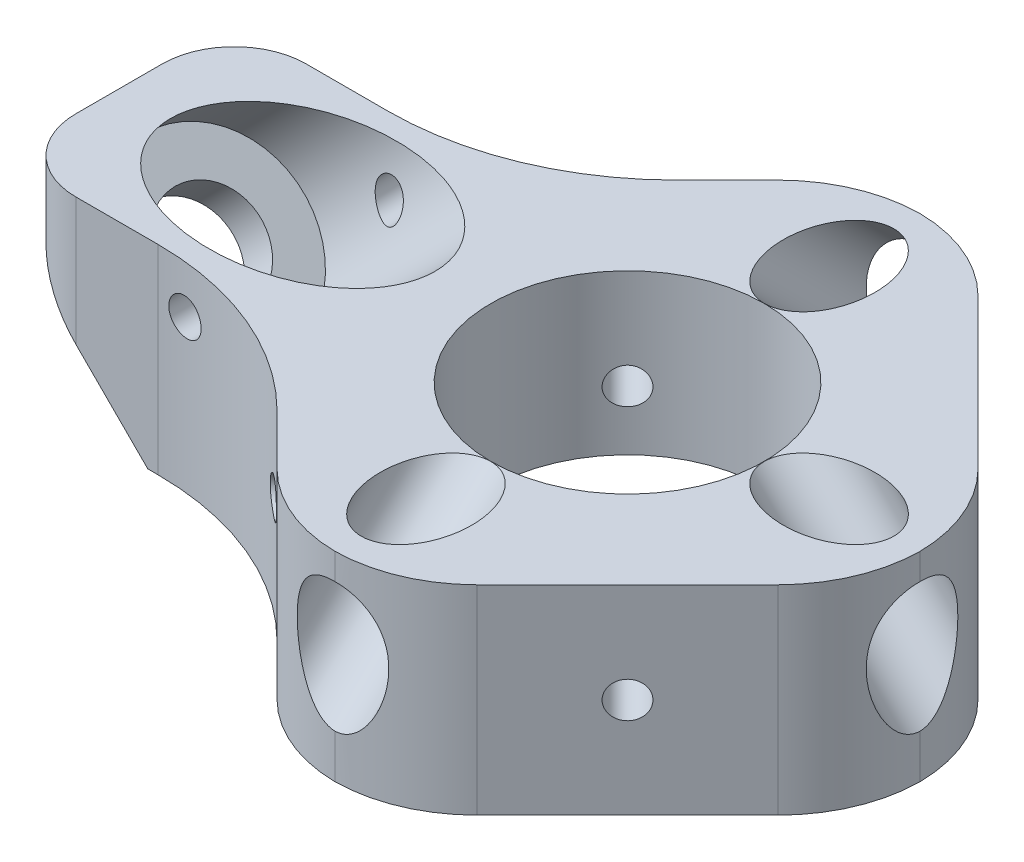
from build123d import *

# Parameters (mm, degrees)
BOSS_EXTRUDE1_DEPTH             = 13.86
SKETCH20_R                      = 15.5
CUT_EXTRUDE14_DEPTH             = 2.79
CHAMFER1_SIZE                   = 10
FILLET1_R                       = 2
SKETCH5_R                       = 1.25
CUT_EXTRUDE1_DEPTH              = 53.273499978
CIRPATTERN1_COUNT               = 4
SKETCH9_R                       = 9.5
CUT_EXTRUDE4_DEPTH              = 44.040729548
CUT_EXTRUDE5_DEPTH              = 44.040729548
CIRPATTERN3_COUNT               = 2
CIRPATTERN3_ANGLE               = 90
SKETCH7_R                       = 3.18
CUT_EXTRUDE2_DEPTH              = 56.113196242
CIRPATTERN2_COUNT               = 2
CIRPATTERN2_ANGLE               = 90
CIRPATTERN2_THE_OTHER_WAY_COUNT = 2
CIRPATTERN2_THE_OTHER_WAY_ANGLE = 90
CUT_EXTRUDE9_DEPTH              = 44.040729548
FILLET2_R                       = 20
FILLET3_R                       = 10
FILLET4_R                       = 5
CUT_EXTRUDE13_DEPTH             = 44.040395064
CUT_EXTRUDE13_DEPTH_BACK        = 44.040395064
SKETCH27_R                      = 1.25
CUT_EXTRUDE15_DEPTH             = 61.833411534
CUT_EXTRUDE15_DEPTH_BACK        = 61.833411534
SKETCH30_R                      = 3.5
CUT_EXTRUDE16_START             = -16
SKETCH31_R                      = 6.5
CUT_EXTRUDE16_DEPTH             = 15.523586
CUT_EXTRUDE17_DEPTH             = 44.040395146
CUT_EXTRUDE17_DEPTH_BACK        = 44.040395146


with BuildPart() as part:
    # Sketch1 → Boss-Extrude1 (new body)
    with BuildSketch(Plane(origin=(0, 0, 0), x_dir=(1, 0, 0), z_dir=(0, 1, 0))):
        Polygon((20.32, -20.32), (-20.32, -20.32), (-20.32, -8), (-35.32, -8), (-35.32, 8), (-20.32, 8), (-20.32, 20.32), (20.32, 20.32), align=None)
    extrude(amount=BOSS_EXTRUDE1_DEPTH)

    # Sketch20 → Cut-Extrude14 (cut)
    with BuildSketch(Plane.XZ):
        with Locations(Location((0, 0, 0), (0, 0, 270))):
            Circle(SKETCH20_R)
    extrude(amount=-CUT_EXTRUDE14_DEPTH, mode=Mode.SUBTRACT)

    # Chamfer1
    chamfer1_edges = [part.edges().sort_by_distance(p)[0] for p in [
        (-20.32, 6.93, -20.32),
        (20.32, 6.93, -20.32),
        (20.32, 6.93, 20.32),
        (-20.32, 6.93, 20.32),
    ]]
    chamfer(chamfer1_edges, length=CHAMFER1_SIZE)

    # Fillet1
    fillet1_edges = [part.edges().sort_by_distance(p)[0] for p in [
        (-20.32, 6.93, -10.32),
        (10.32, 6.93, -20.32),
        (-10.32, 6.93, -20.32),
        (20.32, 6.93, -10.32),
        (20.32, 6.93, 10.32),
        (-10.32, 6.93, 20.32),
        (10.32, 6.93, 20.32),
        (-20.32, 6.93, 10.32),
    ]]
    fillet(fillet1_edges, radius=FILLET1_R)

    # Sketch5 → Cut-Extrude1 (cut, through all)
    with BuildSketch(Plane(origin=(-15.32, 0, -15.32), x_dir=(-0.7071067811865487, 0, 0.7071067811865465), z_dir=(-0.7071067811865465, 0, -0.7071067811865487))):
        with Locations((0, 6.93)):
            Circle(SKETCH5_R)
    cut_extrude1 = extrude(amount=-CUT_EXTRUDE1_DEPTH, mode=Mode.SUBTRACT)

    # CirPattern1: Cut-Extrude1 ×4 about axis
    cirpattern1_axis = Axis((0, 13.86, 0), (0, 1, 0))
    for i in range(1, CIRPATTERN1_COUNT):
        add(cut_extrude1.rotate(cirpattern1_axis, i * 360 / CIRPATTERN1_COUNT), mode=Mode.SUBTRACT)

    # Sketch9 → Cut-Extrude4 (cut, through all)
    with BuildSketch(Plane(origin=(0, 13.86, 0), x_dir=(1, 0, 0), z_dir=(0, 1, 0))):
        with Locations(Location((0, 0, 0), (0, 0, 270))):
            Circle(SKETCH9_R)
    extrude(amount=-CUT_EXTRUDE4_DEPTH, mode=Mode.SUBTRACT)

    # Sketch10 → Cut-Extrude5 (cut, through all)
    with BuildSketch(Plane(origin=(0, 13.86, 0), x_dir=(1, 0, 0), z_dir=(0, 1, 0))):
        with BuildLine():
            Line((20.32, -9.491572875), (20.32, -4.023085751))
            Line((20.32, -4.023085751), (4.023085751, -20.32))
            Line((4.023085751, -20.32), (9.491572875, -20.32))
            ThreePointArc((9.491572875, -20.32), (10.25693974, -20.167759065), (10.905786438, -19.734213562))
            Line((10.905786438, -19.734213562), (19.734213562, -10.905786438))
            ThreePointArc((19.734213562, -10.905786438), (20.167759065, -10.25693974), (20.32, -9.491572875))
        make_face()
    cut_extrude5 = extrude(amount=-CUT_EXTRUDE5_DEPTH, mode=Mode.SUBTRACT)

    # CirPattern3: Cut-Extrude5 ×2 about axis
    cirpattern3_axis = Axis((0, 13.86, 0), (0, 1, 0))
    for i in range(1, CIRPATTERN3_COUNT):
        add(cut_extrude5.rotate(cirpattern3_axis, i * CIRPATTERN3_ANGLE / (CIRPATTERN3_COUNT - 1)), mode=Mode.SUBTRACT)

    # Sketch7 → Cut-Extrude2 (cut, symmetric)
    with BuildSketch(Plane(origin=(14, 13.86, 0), x_dir=(-0.7071067811865488, -0.7071067811865464, 0), z_dir=(-0.7071067811865464, 0.7071067811865488, 0))):
        Circle(SKETCH7_R)
    cut_extrude2 = extrude(amount=CUT_EXTRUDE2_DEPTH, both=True, mode=Mode.SUBTRACT)

    # CirPattern2: Cut-Extrude2 ×2 about axis
    cirpattern2_axis = Axis((0, 13.86, 0), (0, 1, 0))
    for i in range(1, CIRPATTERN2_COUNT):
        add(cut_extrude2.rotate(cirpattern2_axis, i * CIRPATTERN2_ANGLE / (CIRPATTERN2_COUNT - 1)), mode=Mode.SUBTRACT)

    # CirPattern2 the other way: Cut-Extrude2 ×2 about axis
    cirpattern2_the_other_way_axis = Axis((0, 13.86, 0), (0, -1, 0))
    for i in range(1, CIRPATTERN2_THE_OTHER_WAY_COUNT):
        add(cut_extrude2.rotate(cirpattern2_the_other_way_axis, i * CIRPATTERN2_THE_OTHER_WAY_ANGLE / (CIRPATTERN2_THE_OTHER_WAY_COUNT - 1)), mode=Mode.SUBTRACT)

    # Sketch19 → Cut-Extrude9 (cut, through all)
    with BuildSketch(Plane(origin=(0, 13.86, 0), x_dir=(1, 0, 0), z_dir=(0, 1, 0))):
        Polygon((-20.32, -8), (-17.403745922, -8), (-16.343085751, -8), (-4.023085751, -20.32), (-20.32, -20.32), align=None)
    cut_extrude9 = extrude(amount=-CUT_EXTRUDE9_DEPTH, mode=Mode.SUBTRACT)

    # Mirror1: Cut-Extrude9 across plane
    add(cut_extrude9.mirror(Plane.XY), mode=Mode.SUBTRACT)

    # Fillet2
    # the kernel refuses this fillet: 20 mm, written as the material it adds along each edge
    with BuildSketch(Plane(origin=(-16.343085751, 13.86, 8), x_dir=(-1, 0, 0), z_dir=(0, -1, 0))) as fillet2_piece_1_section:
        with BuildLine():
            CenterArc((FILLET2_R * 0.414213562373, -FILLET2_R), FILLET2_R, 90, 45)
            Line((-FILLET2_R * 0.292893218813, -FILLET2_R * 0.292893218813), (0, 0))
            Line((0, 0), (FILLET2_R * 0.414213562373, 0))
        make_face()
    fillet2_piece_1 = extrude(amount=13.86, mode=Mode.PRIVATE)
    fillet2_piece_1 = fillet2_piece_1 - Plane(origin=(-13.058090505, 6.93, 13.058090505), x_dir=(0.7071067811865464, 0, 0.7071067811865488), z_dir=(-0.7071067811865488, 0, 0.7071067811865464)) * Cylinder(1.25, 61, mode=Mode.PRIVATE)
    add(fillet2_piece_1)
    with BuildSketch(Plane(origin=(-16.343085751, 13.86, -8), x_dir=(0.7071067811865477, 0, -0.7071067811865475), z_dir=(0, -1, 0))) as fillet2_piece_2_section:
        with BuildLine():
            CenterArc((FILLET2_R * 0.414213562373, -FILLET2_R), FILLET2_R, 90, 45)
            Line((-FILLET2_R * 0.292893218813, -FILLET2_R * 0.292893218813), (0, 0))
            Line((0, 0), (FILLET2_R * 0.414213562373, 0))
        make_face()
    fillet2_piece_2 = extrude(amount=13.86, mode=Mode.PRIVATE)
    fillet2_piece_2 = fillet2_piece_2 - Plane(origin=(-13.058085033, 6.93, -13.058085033), x_dir=(-0.7071067811865487, 0, 0.7071067811865465), z_dir=(-0.7071067811865465, 0, -0.7071067811865487)) * Cylinder(1.25, 61, mode=Mode.PRIVATE)
    add(fillet2_piece_2)

    # Fillet3
    # the kernel refuses this fillet: 10 mm, written as the material it takes off along each edge
    with BuildSketch(Plane(origin=(-4.023085751, 24.215339059, -20.32), x_dir=(1, 0, 0), z_dir=(0, -1, 0)), Plane(origin=(4.023085751, 24.215339059, -20.32), x_dir=(0.7071067811865501, 0, 0.707106781186545), z_dir=(0, -1, 0)), Plane(origin=(20.32, 24.215339059, -4.023085751), x_dir=(0, 0, 1), z_dir=(0, -1, 0)), Plane(origin=(20.32, 24.215339059, 4.023085751), x_dir=(-0.7071067811865476, 0, 0.7071067811865476), z_dir=(0, -1, 0))) as fillet3_piece_1:
        with BuildLine():
            CenterArc((FILLET3_R * 0.414213562373, FILLET3_R), FILLET3_R, 225, 45)
            Line((-FILLET3_R * 0.292893218813, FILLET3_R * 0.292893218813), (0, 0))
            Line((0, 0), (FILLET3_R * 0.414213562373, 0))
        make_face()
    extrude(amount=34.570678119, mode=Mode.SUBTRACT)
    with BuildSketch(Plane(origin=(4.023085751, 24.215339059, 20.32), x_dir=(0.7071067811865472, 0, -0.7071067811865477), z_dir=(0, -1, 0)), Plane(origin=(-4.023085751, 24.215339059, 20.32), x_dir=(1, 0, 0), z_dir=(0, -1, 0))) as fillet3_piece_2:
        with BuildLine():
            CenterArc((FILLET3_R * 0.414213562373, -FILLET3_R), FILLET3_R, 90, 45)
            Line((-FILLET3_R * 0.292893218813, -FILLET3_R * 0.292893218813), (0, 0))
            Line((0, 0), (FILLET3_R * 0.414213562373, 0))
        make_face()
    extrude(amount=34.570678119, mode=Mode.SUBTRACT)

    # Fillet4
    fillet4_edges = [part.edges().sort_by_distance(p)[0] for p in [
        (-35.32, 6.93, 8),
        (-35.32, 6.93, -8),
    ]]
    fillet(fillet4_edges, radius=FILLET4_R)

    # Sketch27 → Cut-Extrude13 (cut, two sides: drawn at the far end of the back side and taken through both)
    with BuildSketch(Plane.XY.offset(-CUT_EXTRUDE13_DEPTH_BACK)):
        with Locations((-22.59623883, 10.555552458)):
            Circle(SKETCH27_R)
    extrude(amount=CUT_EXTRUDE13_DEPTH + CUT_EXTRUDE13_DEPTH_BACK, mode=Mode.SUBTRACT)

    # Sketch30 → Cut-Extrude15 (cut, two sides: drawn at the far end of the back side and taken through both)
    with BuildSketch(Plane(origin=(-35.32, 13.86, 0), x_dir=(0.7071067811865488, -0.7071067811865464, 0), z_dir=(0.7071067811865464, 0.7071067811865488, 0)).offset(-CUT_EXTRUDE15_DEPTH_BACK)):
        with Locations(Location((9.023586129, 0, 0), (0, 0, 121.002719134))):
            Circle(SKETCH30_R)
    extrude(amount=CUT_EXTRUDE15_DEPTH + CUT_EXTRUDE15_DEPTH_BACK, mode=Mode.SUBTRACT)

    # Sketch31 → Cut-Extrude16 (cut)
    with BuildSketch(Plane(origin=(-24.006291501, 25.173708499, 0), x_dir=(0.7071067811865488, -0.7071067811865464, 0), z_dir=(0.7071067811865464, 0.7071067811865488, 0)).offset(CUT_EXTRUDE16_START)):
        with Locations(Location((9.023586129, 0, 0), (0, 0, 180))):
            Circle(SKETCH31_R)
    extrude(amount=CUT_EXTRUDE16_DEPTH, mode=Mode.SUBTRACT)

    # Sketch32 → Cut-Extrude17 (cut, two sides: drawn at the far end of the back side and taken through both)
    with BuildSketch(Plane.XY.offset(-CUT_EXTRUDE17_DEPTH_BACK)):
        Polygon((-35.32, 10), (-35.32, 0), (-25.32, 0), align=None)
    extrude(amount=CUT_EXTRUDE17_DEPTH + CUT_EXTRUDE17_DEPTH_BACK, mode=Mode.SUBTRACT)


solid = part.part
